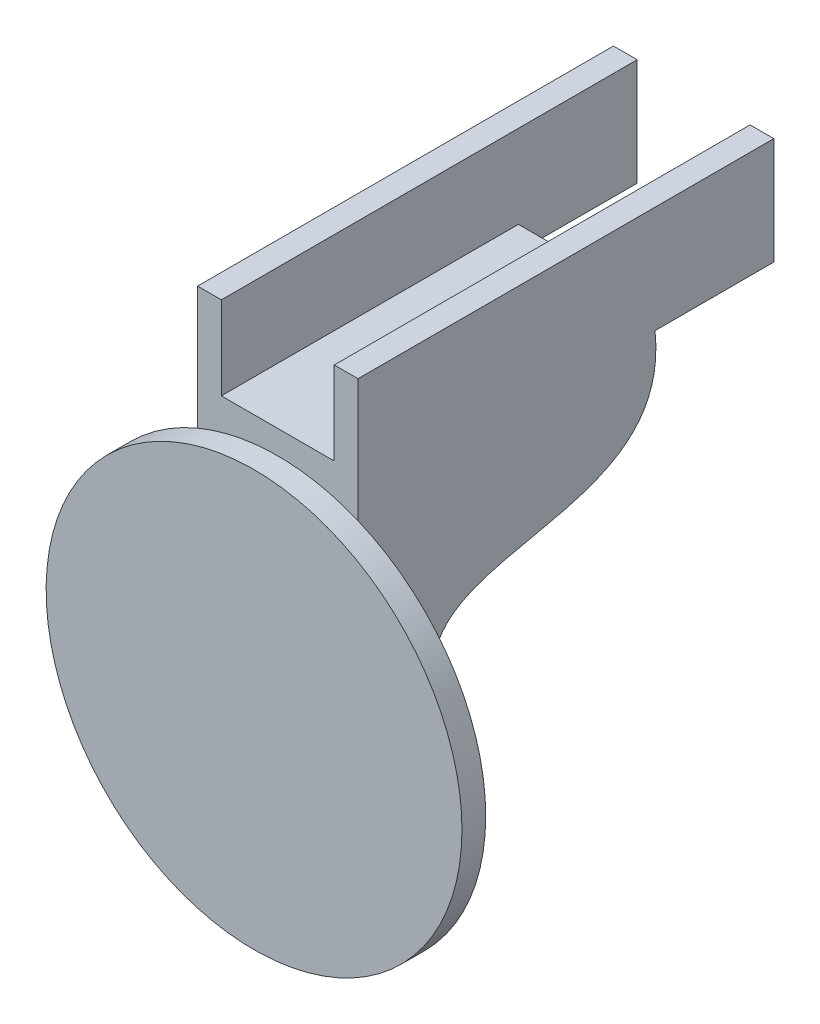
from build123d import *

# Parameters (mm, degrees)
SALIENTE_EXTRUIR2_DEPTH = 35
CROQUIS4_W              = 9.5
CROQUIS4_H              = 10
CORTAR_EXTRUIR1_DEPTH   = 70
SALIENTE_EXTRUIR3_DEPTH = 13.5
CROQUIS7_R              = 17.5
SALIENTE_EXTRUIR4_DEPTH = 2
CORTAR_EXTRUIR2_START   = -3.758954918
CORTAR_EXTRUIR2_DEPTH   = 3.758954918


# Read off the part's stored shape, not the designer's step: Cortar-Extruir2
with BuildPart() as part:
    # Croquis3 → Saliente-Extruir2 (new body)
    with BuildSketch(Plane.XY):
        Polygon((-207.132131222, -11.93013618), (-207.132131222, -18.93013618), (-207.132131222, -20.93013618), (-193.632131222, -20.93013618), (-193.632131222, -11.93013618), (-195.632131222, -11.93013618), (-195.632131222, -18.93013618), (-205.132131222, -18.93013618), (-205.132131222, -11.93013618), align=None)
    extrude(amount=SALIENTE_EXTRUIR2_DEPTH)

    # Croquis4 → Cortar-Extruir1 (cut)
    with BuildSketch(Plane(origin=(0, -18.93013618, 0), x_dir=(1, 0, 0), z_dir=(0, 1, 0))):
        with Locations((-200.382131222, -5)):
            Rectangle(CROQUIS4_W, CROQUIS4_H)
    extrude(amount=-CORTAR_EXTRUIR1_DEPTH, mode=Mode.SUBTRACT)

    # Croquis5 → Saliente-Extruir3 (add)
    with BuildSketch(Plane(origin=(-193.632131222, 0, 0), x_dir=(0, 0, -1), z_dir=(1, 0, 0))):
        with BuildLine():
            Line((-35, -20.93013618), (-35, -55.93013618))
            add(Edge.make_bspline(
                [(-10, -20.93013618), (-8.754688835, -32.622751364), (-40.436340341, -25.169025603), (-23.060908841, -54.287321588), (-35, -55.93013618)],
                knots=[0, 0, 0, 0, 0.470803634, 1, 1, 1, 1], degree=3))
            Line((-10, -20.93013618), (-35, -20.93013618))
        make_face()
    extrude(amount=-SALIENTE_EXTRUIR3_DEPTH)

    # Croquis7 → Saliente-Extruir4 (add)
    with BuildSketch(Plane.XY.offset(35)):
        with Locations(Location((-200.382131222, -38.43013618, 0), (0, 0, 112.688091151))):
            Circle(CROQUIS7_R)
    extrude(amount=SALIENTE_EXTRUIR4_DEPTH)

    # Cortar-Extruir2 outline → Cortar-Extruir2 (cut)
    with BuildSketch(Plane.XY.offset(35).offset(CORTAR_EXTRUIR2_START)):
        with BuildLine():
            Line((-193.632131222, -55.93013618), (-193.632131222, -54.575956073))
            ThreePointArc((-193.632131222, -54.575956073), (-196.939882547, -55.588251579), (-200.382131222, -55.93013618))
            Line((-200.382131222, -55.93013618), (-193.632131222, -55.93013618))
        make_face()
        with BuildLine():
            Line((-207.132131222, -55.93013618), (-200.382131222, -55.93013618))
            ThreePointArc((-200.382131222, -55.93013618), (-203.824379897, -55.588251579), (-207.132131222, -54.575956073))
            Line((-207.132131222, -54.575956073), (-207.132131222, -55.93013618))
        make_face()
    extrude(amount=CORTAR_EXTRUIR2_DEPTH, mode=Mode.SUBTRACT)


solid = part.part
